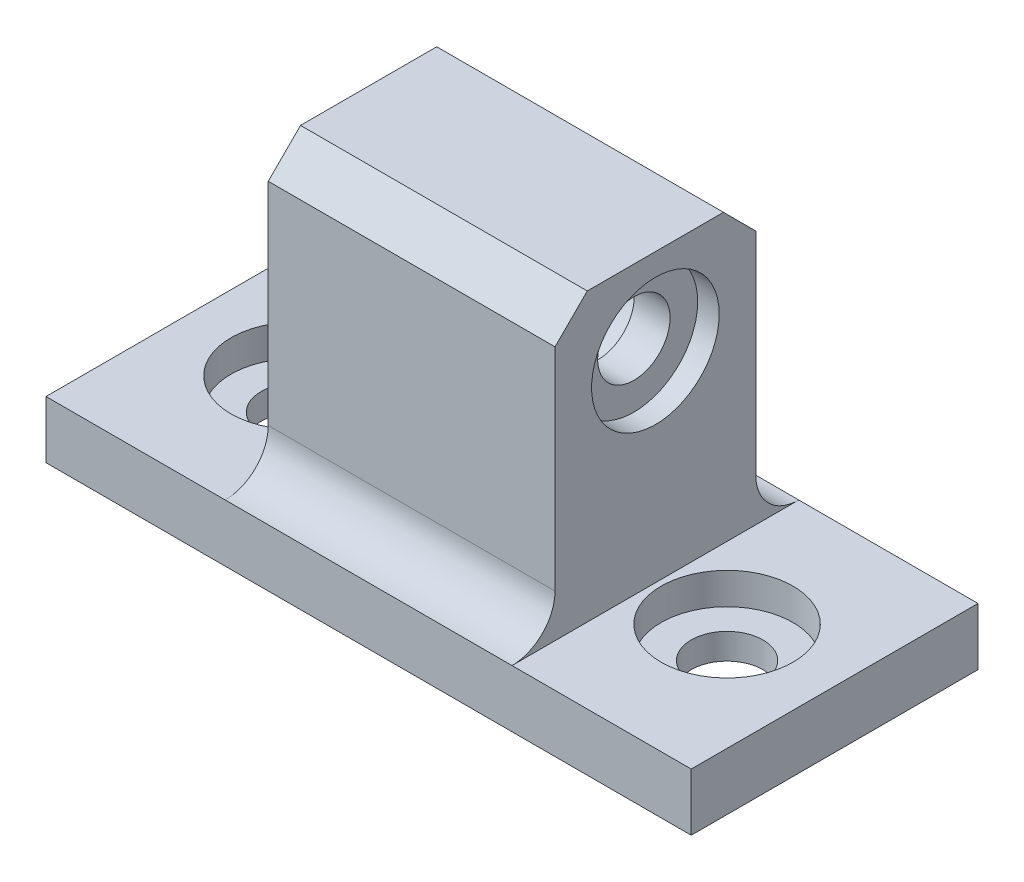
from build123d import *

# Parameters (mm, degrees)
SKETCH1_W           = 45
SKETCH1_H           = 20
SKETCH1_R           = 4.6
SKETCH1_W_2         = 20
SKETCH1_H_2         = 14
SKETCH1_R_2         = 2.5
BOSS_EXTRUDE1_DEPTH = 4
BOSS_EXTRUDE2_START = 4
SKETCH1_4_W         = 20
SKETCH1_4_H         = 14
BOSS_EXTRUDE2_DEPTH = 20
CUT_EXTRUDE1_START  = 4
SKETCH1_5_R         = 4.6
CUT_EXTRUDE1_DEPTH  = 2.2
CUT_EXTRUDE2_START  = -20
SKETCH2_R           = 4.6
CUT_EXTRUDE2_DEPTH  = 16
SKETCH2_6_R         = 2.525
CUT_EXTRUDE3_DEPTH  = 4
SKETCH2_7_R         = 4.45
SKETCH2_7_R_2       = 2.525
CUT_EXTRUDE4_DEPTH  = 1.5
FILLET1_R           = 3
CHAMFER1_SIZE       = 2.25


with BuildPart() as part:
    # Sketch1 → Boss-Extrude1 (new body)
    # profile 1 of 4: a face of its own
    with BuildSketch(Plane(origin=(0, 0, 0), x_dir=(1, 0, 0), z_dir=(0, 1, 0))):
        Rectangle(SKETCH1_W, SKETCH1_H)
        with Locations((15, 0)):
            Circle(SKETCH1_R, mode=Mode.SUBTRACT)
        with Locations((-15, 0)):
            Circle(SKETCH1_R, mode=Mode.SUBTRACT)
        Rectangle(SKETCH1_W_2, SKETCH1_H_2, mode=Mode.SUBTRACT)
    # profile 2 of 4: a face of its own
    with BuildSketch(Plane(origin=(0, 0, 0), x_dir=(1, 0, 0), z_dir=(0, 1, 0))):
        with Locations((-15, 0)):
            Circle(SKETCH1_R)
        with Locations(Location((-15, 0, 0), (0, 0, 270))):
            Circle(SKETCH1_R_2, mode=Mode.SUBTRACT)
    # profile 3 of 4: a face of its own
    with BuildSketch(Plane(origin=(0, 0, 0), x_dir=(1, 0, 0), z_dir=(0, 1, 0))):
        with Locations((15, 0)):
            Circle(SKETCH1_R)
        with Locations(Location((15, 0, 0), (0, 0, 270))):
            Circle(SKETCH1_R_2, mode=Mode.SUBTRACT)
    # profile 4 of 4: a face of its own
    with BuildSketch(Plane(origin=(0, 0, 0), x_dir=(1, 0, 0), z_dir=(0, 1, 0))):
        Rectangle(SKETCH1_W_2, SKETCH1_H_2)
    extrude(amount=BOSS_EXTRUDE1_DEPTH)

    # Sketch1<4> → Boss-Extrude2 (add)
    with BuildSketch(Plane(origin=(0, 0, 0), x_dir=(1, 0, 0), z_dir=(0, 1, 0)).offset(BOSS_EXTRUDE2_START)):
        Rectangle(SKETCH1_4_W, SKETCH1_4_H)
    extrude(amount=BOSS_EXTRUDE2_DEPTH)

    # Sketch1<5> → Cut-Extrude1 (cut)
    with BuildSketch(Plane(origin=(0, 0, 0), x_dir=(1, 0, 0), z_dir=(0, 1, 0)).offset(CUT_EXTRUDE1_START)):
        with Locations(Location((15, 0, 0), (0, 0, 270))):
            Circle(SKETCH1_5_R)
        with Locations(Location((-15, 0, 0), (0, 0, 270))):
            Circle(SKETCH1_5_R)
    extrude(amount=-CUT_EXTRUDE1_DEPTH, mode=Mode.SUBTRACT)

    # Sketch2 → Cut-Extrude2 (cut)
    with BuildSketch(Plane(origin=(10, 0, 0), x_dir=(0, 0, -1), z_dir=(1, 0, 0)).offset(CUT_EXTRUDE2_START)):
        with Locations(Location((0, 18, 0), (0, 0, 180))):
            Circle(SKETCH2_R)
    extrude(amount=CUT_EXTRUDE2_DEPTH, mode=Mode.SUBTRACT)

    # Sketch2<6> → Cut-Extrude3 (cut)
    with BuildSketch(Plane(origin=(10, 0, 0), x_dir=(0, 0, -1), z_dir=(1, 0, 0))):
        with Locations((0, 18)):
            Circle(SKETCH2_6_R)
    extrude(amount=-CUT_EXTRUDE3_DEPTH, mode=Mode.SUBTRACT)

    # Sketch2<7> → Cut-Extrude4 (cut)
    with BuildSketch(Plane(origin=(10, 0, 0), x_dir=(0, 0, -1), z_dir=(1, 0, 0))):
        with Locations((0, 18)):
            Circle(SKETCH2_7_R)
        with Locations((0, 18)):
            Circle(SKETCH2_7_R_2, mode=Mode.SUBTRACT)
    extrude(amount=-CUT_EXTRUDE4_DEPTH, mode=Mode.SUBTRACT)

    # Fillet1
    fillet1_edges = [part.edges().sort_by_distance(p)[0] for p in [
        (0, 4, 7),
        (0, 4, -7),
    ]]
    fillet(fillet1_edges, radius=FILLET1_R - 0.0001)  # a hair under: the kernel refuses the full size

    # Chamfer1
    chamfer1_edges = [part.edges().sort_by_distance(p)[0] for p in [
        (0, 24, -7),
        (0, 24, 7),
    ]]
    chamfer(chamfer1_edges, length=CHAMFER1_SIZE)


solid = part.part
